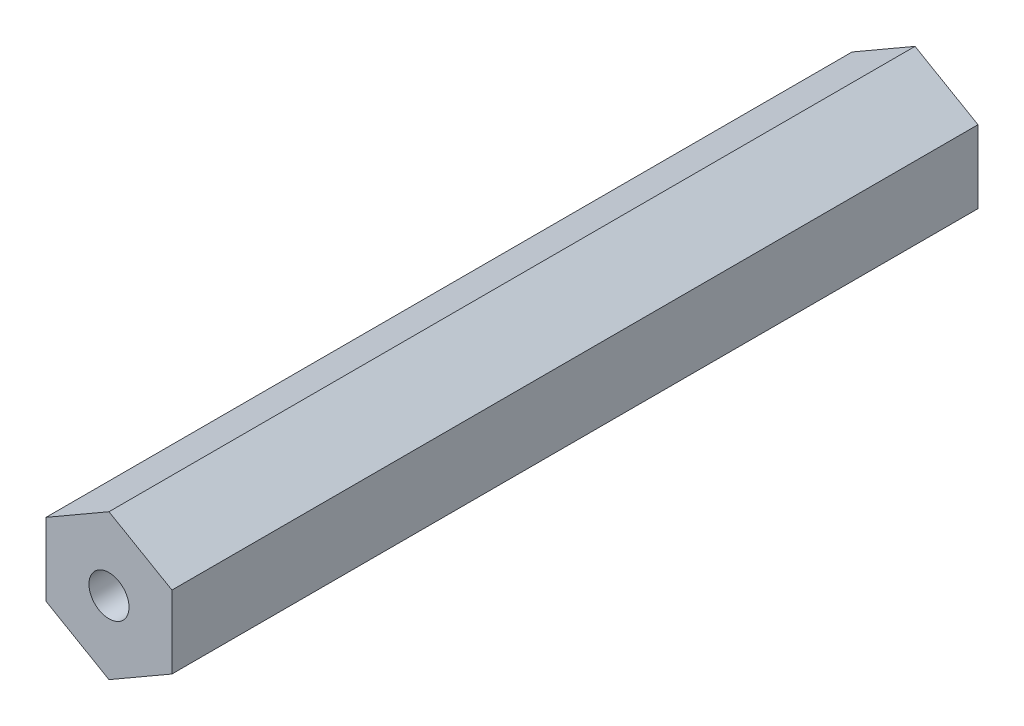
from build123d import *

# Parameters (mm, degrees)
BOSS_EXTRUDE1_DEPTH = 40.64


with BuildPart() as part:
    # Sketch1 → Boss-Extrude1 (new, symmetric)
    with BuildSketch(Plane.XY):
        Polygon((0, 7.332348419), (-6.35, 3.666174209), (-6.35, -3.666174209), (0, -7.332348419), (6.35, -3.666174209), (6.35, 3.666174209), align=None)
    extrude(amount=BOSS_EXTRUDE1_DEPTH, both=True)

    # Sketch5 → #10-32 Tapped Hole1 (revolve, cut)
    with BuildSketch(Plane(origin=(0, 0, -40.64), x_dir=(0, 1, 0), z_dir=(1, 0, 0))):
        Polygon((0, 0), (0, 13.151317848), (2.0193, 11.938), (2.0193, 0), align=None)
    f_10_32_tapped_hole1 = revolve(axis=Axis((0, 0, -46.99), (0, 0, 1)), mode=Mode.SUBTRACT)

    # Mirror1: #10-32 Tapped Hole1 across plane
    add(f_10_32_tapped_hole1.mirror(Plane.XY), mode=Mode.SUBTRACT)


solid = part.part
